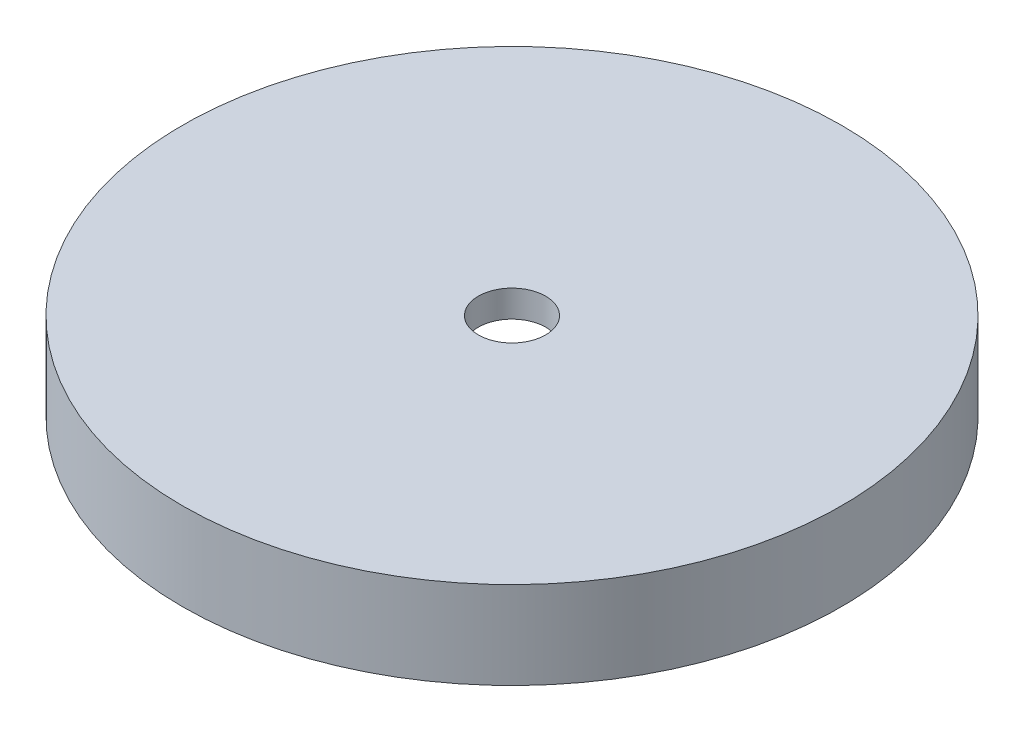
from build123d import *

# Parameters (mm, degrees)
SKETCH1_R           = 24.5
SKETCH1_R_2         = 18.5
BOSS_EXTRUDE1_DEPTH = 4.5
SKETCH2_R           = 24.5
BOSS_EXTRUDE2_DEPTH = 2
SKETCH3_R           = 2.5
CUT_EXTRUDE1_DEPTH  = 36.252659474


with BuildPart() as part:
    # Sketch1 → Boss-Extrude1 (new body)
    with BuildSketch(Plane(origin=(0, 0, 0), x_dir=(1, 0, 0), z_dir=(0, 1, 0))):
        Circle(SKETCH1_R)
        Circle(SKETCH1_R_2, mode=Mode.SUBTRACT)
    extrude(amount=BOSS_EXTRUDE1_DEPTH)

    # Sketch2 → Boss-Extrude2 (add)
    with BuildSketch(Plane(origin=(0, 4.5, 0), x_dir=(1, 0, 0), z_dir=(0, 1, 0))):
        Circle(SKETCH2_R)
    extrude(amount=BOSS_EXTRUDE2_DEPTH)

    # Sketch3 → Cut-Extrude1 (cut, through all)
    with BuildSketch(Plane.XZ):
        Circle(SKETCH3_R)
    extrude(amount=-CUT_EXTRUDE1_DEPTH, mode=Mode.SUBTRACT)


solid = part.part
